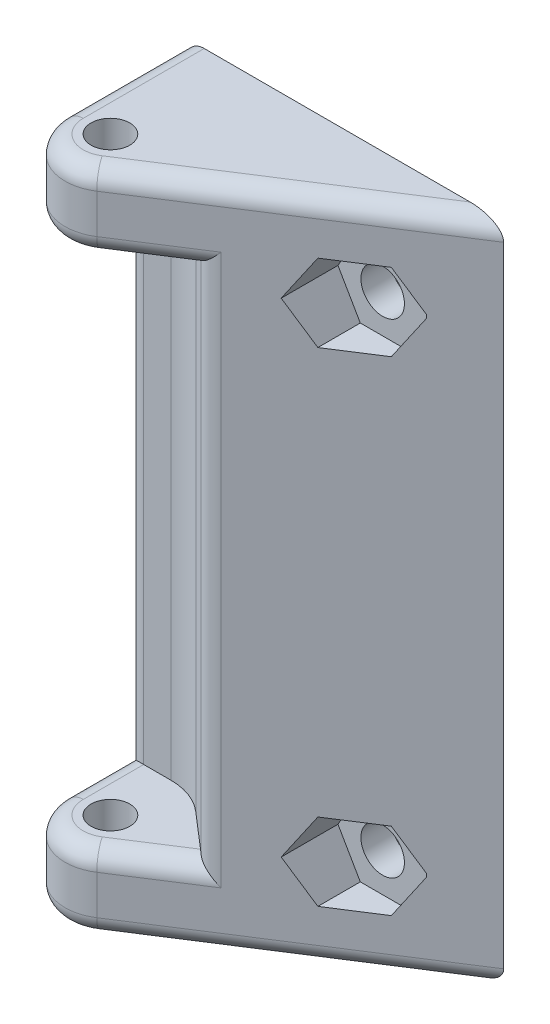
from build123d import *

# Parameters (mm, degrees)
SKETCH1_R           = 2.032
BOSS_EXTRUDE1_DEPTH = 34.925
CUT_EXTRUDE4_DEPTH  = 26.9875
BOSS_EXTRUDE2_DEPTH = 6.35
SKETCH13_R          = 2.286
CUT_EXTRUDE9_DEPTH  = 49.386208327
CUT_EXTRUDE10_START = -3.175
CUT_EXTRUDE10_DEPTH = 46.211208327
FILLET1_R           = 1.905


with BuildPart() as part:
    # Sketch1 → Boss-Extrude1 (new, symmetric)
    with BuildSketch(Plane(origin=(0, 0, 0), x_dir=(1, 0, 0), z_dir=(0, 1, 0))):
        with BuildLine():
            Line((-4.7625, 12.7), (-4.7625, 0))
            ThreePointArc((-4.7625, 0), (-2.282585023, -4.179857876), (2.574491858, -4.006669181))
            Line((2.574491858, -4.006669181), (28.575, 12.7))
            Line((28.575, 12.7), (-4.7625, 12.7))
        make_face()
        Circle(SKETCH1_R, mode=Mode.SUBTRACT)
    extrude(amount=BOSS_EXTRUDE1_DEPTH, both=True)

    # Sketch6 → Cut-Extrude4 (cut, symmetric)
    with BuildSketch(Plane(origin=(0, 0, 0), x_dir=(1, 0, 0), z_dir=(0, 1, 0))):
        with BuildLine():
            Line((0, 6.35), (-4.7625, 6.35))
            Line((-4.7625, 6.35), (-4.7625, 0))
            ThreePointArc((-4.7625, 0), (-2.282585023, -4.179857876), (2.574491858, -4.006669181))
            Line((2.574491858, -4.006669181), (9.32809114, 0.332867122))
            Line((9.32809114, 0.332867122), (4.15122564, 4.805187373))
            ThreePointArc((4.15122564, 4.805187373), (2.214673811, 5.951278847), (0, 6.35))
        make_face()
    extrude(amount=CUT_EXTRUDE4_DEPTH, both=True, mode=Mode.SUBTRACT)

    # Sketch7 → Boss-Extrude2 (add)
    with BuildSketch(Plane(origin=(0, 0, -12.7), x_dir=(-1, 0, 0), z_dir=(0, 0, -1))):
        with BuildLine():
            Line((4.7625, 19.05), (4.7625, 34.925))
            Line((4.7625, 34.925), (-4.664395577, 34.925))
            Line((-4.664395577, 34.925), (-8.810068331, 21.031827745))
            ThreePointArc((-8.810068331, 21.031827745), (-1.167052786, 25.908247814), (4.7625, 19.05))
        make_face()
        with BuildLine():
            Line((4.7625, -19.05), (4.7625, -34.925))
            Line((4.7625, -34.925), (-4.664395577, -34.925))
            Line((-4.664395577, -34.925), (-8.810068331, -21.031827745))
            ThreePointArc((-8.810068331, -21.031827745), (-1.167052786, -25.908247814), (4.7625, -19.05))
        make_face()
    extrude(amount=-BOSS_EXTRUDE2_DEPTH)

    # Sketch13 → Cut-Extrude9 (cut, through all)
    with BuildSketch(Plane(origin=(0, 0, -12.7), x_dir=(-1, 0, 0), z_dir=(0, 0, -1))):
        with Locations((-19.05, 25.4)):
            Circle(SKETCH13_R)
        with Locations((-19.05, -25.4)):
            Circle(SKETCH13_R)
    extrude(amount=-CUT_EXTRUDE9_DEPTH, mode=Mode.SUBTRACT)

    # Sketch14 → Cut-Extrude10 (cut, through all)
    with BuildSketch(Plane(origin=(0, 0, -12.7), x_dir=(-1, 0, 0), z_dir=(0, 0, -1)).offset(CUT_EXTRUDE10_START)):
        Polygon((-14.357297012, 25.4), (-16.703648506, 29.464), (-21.396351494, 29.464), (-23.742702988, 25.4), (-21.396351494, 21.336), (-16.703648506, 21.336), align=None)
        Polygon((-14.357297012, -25.4), (-16.703648506, -21.336), (-21.396351494, -21.336), (-23.742702988, -25.4), (-21.396351494, -29.464), (-16.703648506, -29.464), align=None)
    extrude(amount=-CUT_EXTRUDE10_DEPTH, mode=Mode.SUBTRACT)

    # Fillet1
    fillet1_edges = [part.edges().sort_by_distance(p)[0] for p in [
        (-4.7625, -34.925, -6.35),
        (-2.282585023, -34.925, 4.179857876),
        (15.574745929, 34.925, -4.34666541),
        (-2.282585023, 34.925, 4.179857876),
        (15.574745929, -34.925, -4.34666541),
        (-4.7625, 34.925, -6.35),
        (-4.7625, -26.9875, -3.175),
        (5.951291499, -26.9875, 1.836901029),
        (-4.7625, 26.9875, -3.175),
        (-2.282585023, 26.9875, 4.179857876),
        (-2.282585023, -26.9875, 4.179857876),
        (5.951291499, 26.9875, 1.836901029),
        (-4.7625, 0, -6.35),
        (9.32809114, 0, -0.332867122),
    ]]
    fillet(fillet1_edges, radius=FILLET1_R)


solid = part.part
